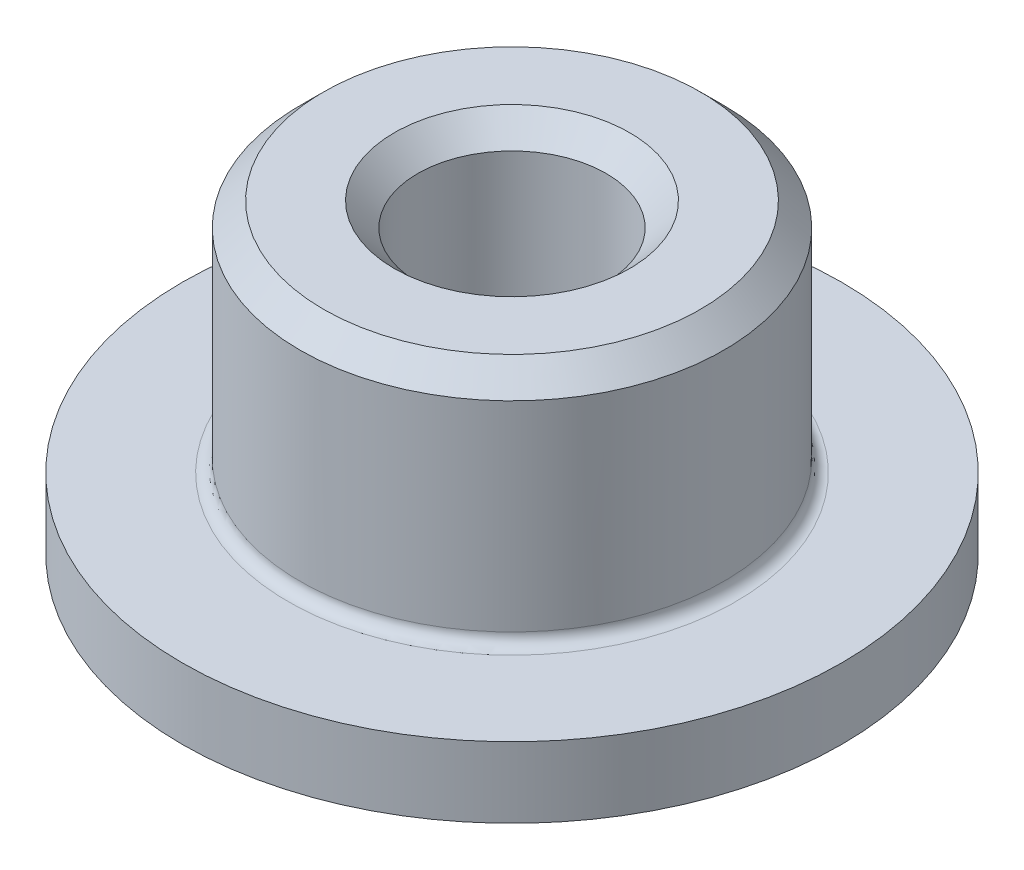
from build123d import *

# Parameters (mm, degrees)
SKETCH1_R           = 4.5
SKETCH1_R_2         = 2
BOSS_EXTRUDE1_DEPTH = 5
BOSS_EXTRUDE2_START = 1.5
SKETCH2_R           = 7
SKETCH2_R_2         = 2
BOSS_EXTRUDE2_DEPTH = 1.5
CHAMFER1_SIZE       = 0.5
FILLET1_R           = 0.25
CHAMFER2_SIZE       = 0.5


with BuildPart() as part:
    # Sketch1 → Boss-Extrude1 (new body)
    with BuildSketch(Plane(origin=(0, 0, 0), x_dir=(1, 0, 0), z_dir=(0, 1, 0))):
        Circle(SKETCH1_R)
        Circle(SKETCH1_R_2, mode=Mode.SUBTRACT)
    extrude(amount=BOSS_EXTRUDE1_DEPTH)

    # Sketch2 → Boss-Extrude2 (add)
    with BuildSketch(Plane.XZ.offset(BOSS_EXTRUDE2_START)):
        Circle(SKETCH2_R)
        Circle(SKETCH2_R_2, mode=Mode.SUBTRACT)
    extrude(amount=-BOSS_EXTRUDE2_DEPTH)

    # Chamfer1
    chamfer1_edges = [part.edges().sort_by_distance(p)[0] for p in [
        (-4.5, 5, 0),
    ]]
    chamfer(chamfer1_edges, length=CHAMFER1_SIZE)

    # Fillet1
    fillet1_edges = [part.edges().sort_by_distance(p)[0] for p in [
        (-4.5, 0, 0),
    ]]
    fillet(fillet1_edges, radius=FILLET1_R)

    # Chamfer2
    chamfer2_edges = [part.edges().sort_by_distance(p)[0] for p in [
        (-2, 5, 0),
        (-2, -1.5, 0),
    ]]
    chamfer(chamfer2_edges, length=CHAMFER2_SIZE)


solid = part.part
